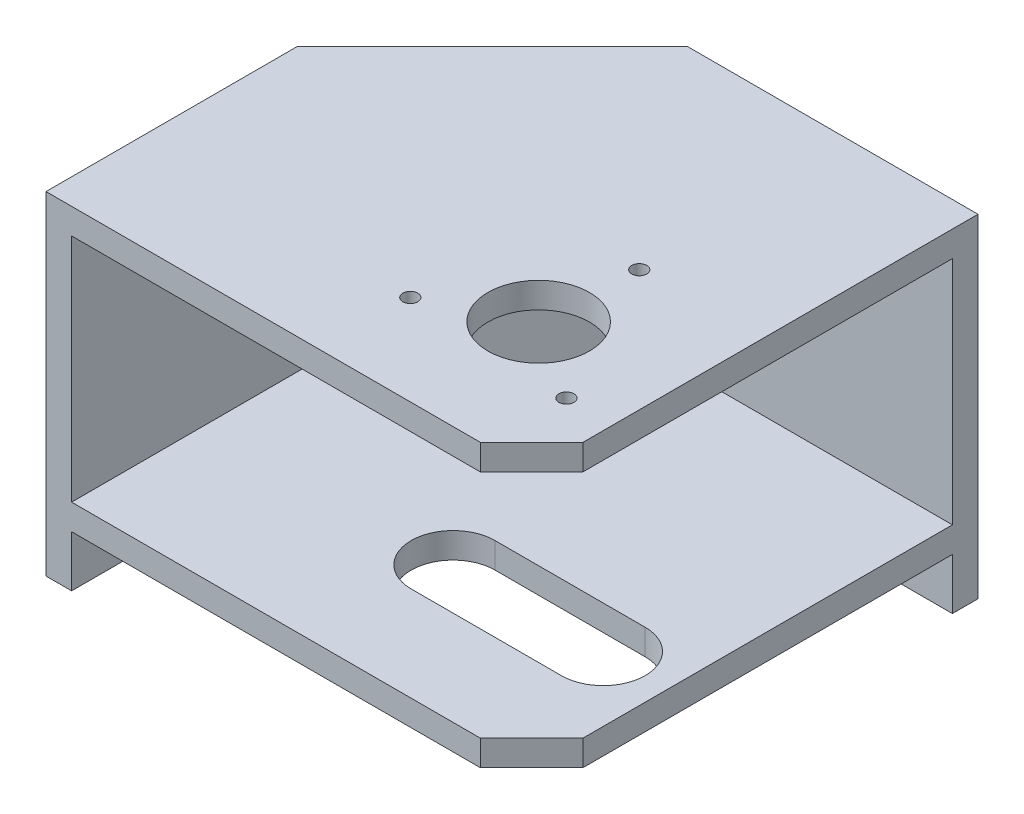
from build123d import *

# Parameters (mm, degrees)
BOSS_EXTRUDE1_DEPTH      = 5
CUT_EXTRUDE1_DEPTH       = 10
BOSS_EXTRUDE2_DEPTH      = 50
BOSS_EXTRUDE2_DEPTH_BACK = 15
LPATTERN1_COUNT          = 2
LPATTERN1_PITCH          = 50
SKETCH4_R                = 9.913323844
CUT_EXTRUDE2_DEPTH       = 20
SKETCH5_R                = 1.464141333
CUT_EXTRUDE3_DEPTH       = 20
CIRPATTERN1_COUNT        = 3


with BuildPart() as part:
    # Sketch1 → Boss-Extrude1 (new body)
    with BuildSketch(Plane(origin=(0, 0, 0), x_dir=(1, 0, 0), z_dir=(0, 1, 0))):
        Polygon((-37.807117263, 14.820378322), (0.192882737, 52.820378322), (56.984640513, 52.820378322), (56.984640513, -24.300370155), (46.984640513, -34.300370155), (-37.807117263, -34.300370155), align=None)
    boss_extrude1 = extrude(amount=BOSS_EXTRUDE1_DEPTH)

    # Sketch2 → Cut-Extrude1 (cut)
    with BuildSketch(Plane(origin=(0, 5, 0), x_dir=(1, 0, 0), z_dir=(0, 1, 0))):
        with BuildLine():
            Line((44.311112051, -15.830308764), (15.000721771, -15.830308764))
            ThreePointArc((15.000721771, -15.830308764), (6.821077972, -7.650664965), (15.000721771, 0.528978834))
            Line((15.000721771, 0.528978834), (44.311112051, 0.528978834))
            ThreePointArc((44.311112051, 0.528978834), (52.49075585, -7.650664965), (44.311112051, -15.830308764))
        make_face()
    extrude(amount=-CUT_EXTRUDE1_DEPTH, mode=Mode.SUBTRACT)

    # Sketch3 → Boss-Extrude2 (add, two sides: drawn at the far end of the back side and taken through both)
    with BuildSketch(Plane(origin=(0, 5, 0), x_dir=(1, 0, 0), z_dir=(0, 1, 0)).offset(-BOSS_EXTRUDE2_DEPTH_BACK)):
        Polygon((0.192882737, 52.820378322), (56.984640513, 52.820378322), (56.984640513, 47.820378322), (2.263950549, 47.820378322), (-32.807117263, 12.74931051), (-32.807117263, -34.300370155), (-37.807117263, -34.300370155), (-37.807117263, 14.820378322), align=None)
    extrude(amount=BOSS_EXTRUDE2_DEPTH + BOSS_EXTRUDE2_DEPTH_BACK)

    # LPattern1: Boss-Extrude1 ×2
    with Locations(*[(0, i * LPATTERN1_PITCH, 0) for i in range(1, LPATTERN1_COUNT)]):
        add(boss_extrude1)

    # Sketch4 → Cut-Extrude2 (cut)
    with BuildSketch(Plane(origin=(0, 55, 0), x_dir=(1, 0, 0), z_dir=(0, 1, 0))):
        with Locations((32.279322551, -8.227284007)):
            Circle(SKETCH4_R)
    extrude(amount=-CUT_EXTRUDE2_DEPTH, mode=Mode.SUBTRACT)

    # Sketch5 → Cut-Extrude3 (cut)
    with BuildSketch(Plane(origin=(0, 55, 0), x_dir=(1, 0, 0), z_dir=(0, 1, 0))):
        with Locations((33.298520323, 10.386485831)):
            Circle(SKETCH5_R)
    cut_extrude3 = extrude(amount=-CUT_EXTRUDE3_DEPTH, mode=Mode.SUBTRACT)

    # CirPattern1: Cut-Extrude3 ×3 about axis
    cirpattern1_axis = Axis((32.279322551, 55, 8.227284007), (0, 1, 0))
    for i in range(1, CIRPATTERN1_COUNT):
        add(cut_extrude3.rotate(cirpattern1_axis, i * 360 / CIRPATTERN1_COUNT), mode=Mode.SUBTRACT)


solid = part.part
